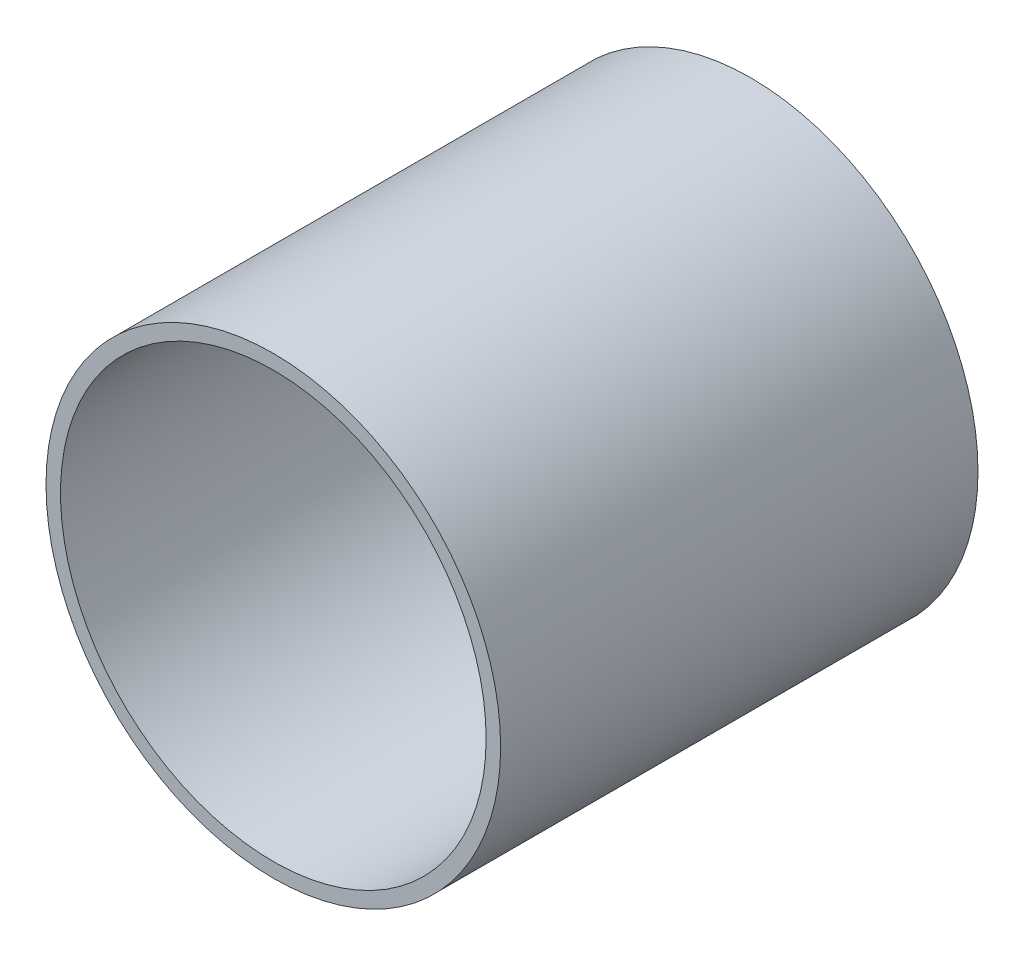
from build123d import *

# Parameters (mm, degrees)
SKETCH1_W           = 300
SKETCH1_H           = 170
BOSS_EXTRUDE1_DEPTH = 225
SHELL1_T            = -10
SKETCH2_R           = 6.5
CUT_EXTRUDE1_DEPTH  = 10
CIRPATTERN1_COUNT   = 4
SKETCH6_OUTSIDE_W   = 384.346
SKETCH6_OUTSIDE_H   = 309.346
SKETCH6_OUTSIDE_R   = 100
CUT_EXTRUDE2_DEPTH  = 412.734137521
SKETCH7_R           = 100
SKETCH7_R_2         = 93.619049124
BOSS_EXTRUDE2_DEPTH = 200


with BuildPart() as part:
    # Sketch1 → Boss-Extrude1 (new body)
    with BuildSketch(Plane(origin=(0, 0, 0), x_dir=(1, 0, 0), z_dir=(0, 1, 0))):
        with Locations((-150, -85)):
            Rectangle(SKETCH1_W, SKETCH1_H)
    extrude(amount=BOSS_EXTRUDE1_DEPTH)

    # Shell1
    shell1_openings = [part.faces().sort_by_distance(p)[0] for p in [
        (-150, 112.5, 170),
    ]]
    offset(amount=SHELL1_T, openings=shell1_openings, kind=Kind.INTERSECTION)

    # Sketch2 → Cut-Extrude1 (cut)
    with BuildSketch(Plane.XY.offset(10)):
        with Locations((-150, 112.5)):
            Circle(SKETCH2_R)
    extrude(amount=-CUT_EXTRUDE1_DEPTH, mode=Mode.SUBTRACT)

    # Sketch5 → M5 Clearance Hole1 (revolve, cut)
    with BuildSketch(Plane(origin=(-134.090097423, 128.409902577, 10), x_dir=(0, -1, 0), z_dir=(1, 0, 0))):
        Polygon((0, 0), (0, 21.652366702), (2.75, 20), (2.75, 0.025), (2.775, 0), align=None)
    m5_clearance_hole1 = revolve(axis=Axis((-134.090097423, 128.409902577, 16.35), (0, 0, -1)), mode=Mode.SUBTRACT)

    # CirPattern1: M5 Clearance Hole1 ×4 about axis
    cirpattern1_axis = Axis((-150, 112.5, 10), (0, 0, 1))
    for i in range(1, CIRPATTERN1_COUNT):
        add(m5_clearance_hole1.rotate(cirpattern1_axis, i * 360 / CIRPATTERN1_COUNT), mode=Mode.SUBTRACT)

    # Sketch6 outside → Cut-Extrude2 (cut, through all)
    with BuildSketch(Plane(origin=(0, 0, 0), x_dir=(-1, 0, 0), z_dir=(0, 0, -1))):
        with Locations((150, 112.5)):
            Rectangle(SKETCH6_OUTSIDE_W, SKETCH6_OUTSIDE_H)
        with Locations((150, 112.5)):
            Circle(SKETCH6_OUTSIDE_R, mode=Mode.SUBTRACT)
    extrude(amount=-CUT_EXTRUDE2_DEPTH, mode=Mode.SUBTRACT)

    # Sketch7 → Boss-Extrude2 (add)
    with BuildSketch(Plane.XY.offset(10)):
        with Locations((-150, 112.5)):
            Circle(SKETCH7_R)
        with Locations((-150, 112.5)):
            Circle(SKETCH7_R_2, mode=Mode.SUBTRACT)
    extrude(amount=BOSS_EXTRUDE2_DEPTH)


solid = part.part
